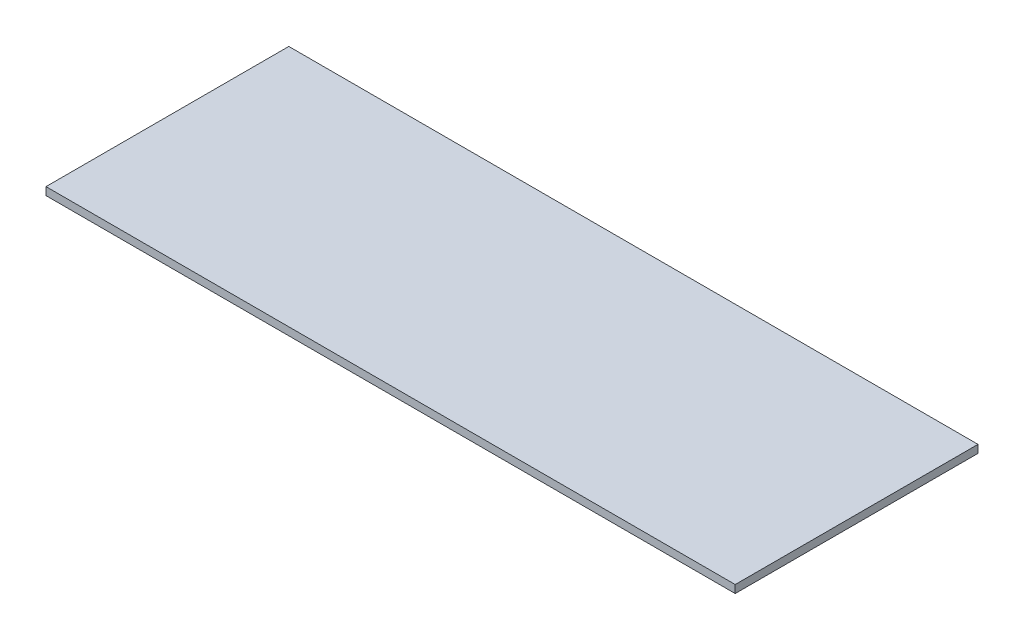
from build123d import *

# Parameters (mm, degrees)
SKETCH1_W           = 440
SKETCH1_H           = 155
BOSS_EXTRUDE1_DEPTH = 5


with BuildPart() as part:
    # Sketch1 → Boss-Extrude1 (new body)
    with BuildSketch(Plane(origin=(0, 0, 0), x_dir=(1, 0, 0), z_dir=(0, 1, 0))):
        with Locations((220, 77.5)):
            Rectangle(SKETCH1_W, SKETCH1_H)
    extrude(amount=BOSS_EXTRUDE1_DEPTH)


solid = part.part
